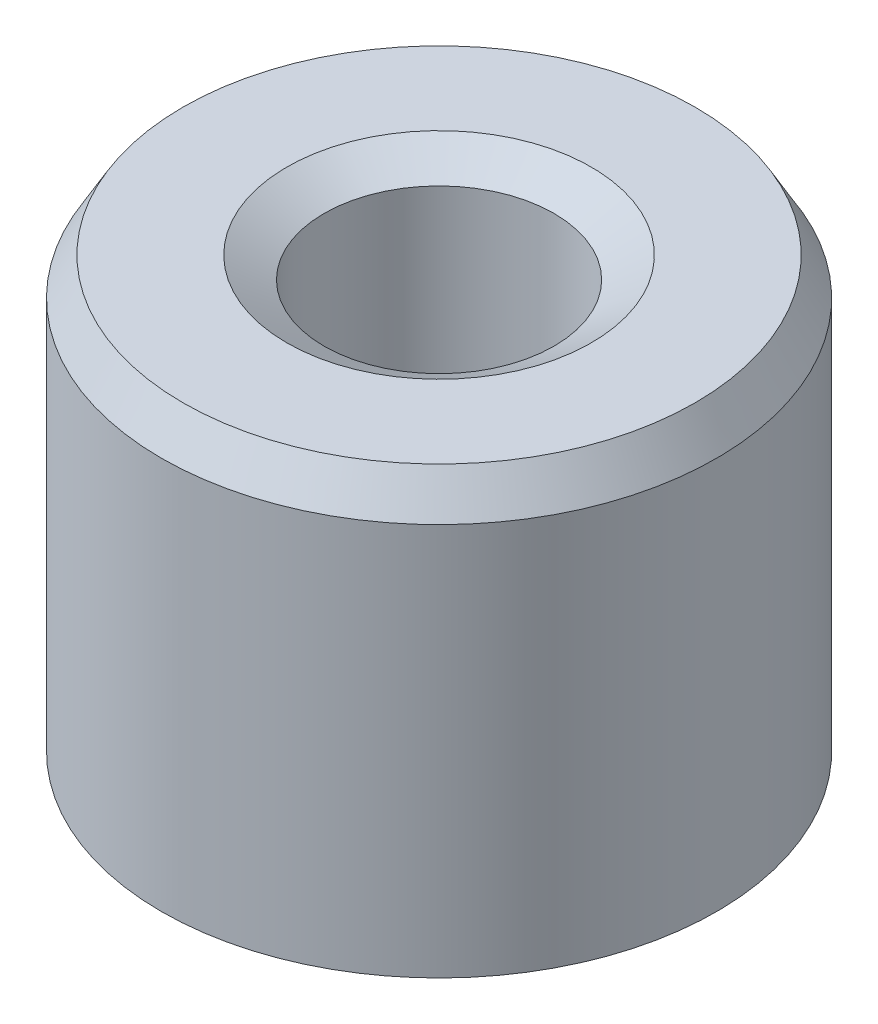
from build123d import *
from OCP.BRepFilletAPI import BRepFilletAPI_MakeChamfer

# Parameters (mm, degrees)
SKETCH1_R           = 25
BOSS_EXTRUDE1_DEPTH = 40.651912495
SKETCH2_R           = 10.355693832
CUT_EXTRUDE1_DEPTH  = 54.875578786
CHAMFER1_SIZE       = 3.356631044
CHAMFER1_SIZE2      = 1.937951837


with BuildPart() as part:
    # Sketch1 → Boss-Extrude1 (new body)
    with BuildSketch(Plane(origin=(0, 0, 0), x_dir=(1, 0, 0), z_dir=(0, 1, 0))):
        Circle(SKETCH1_R)
    extrude(amount=BOSS_EXTRUDE1_DEPTH)

    # Sketch2 → Cut-Extrude1 (cut, through all)
    with BuildSketch(Plane(origin=(0, 0, 0), x_dir=(1, 0, 0), z_dir=(0, 1, 0))):
        Circle(SKETCH2_R)
    extrude(amount=CUT_EXTRUDE1_DEPTH, mode=Mode.SUBTRACT)

    # Chamfer1: one chamfer whose edges measure the first distance from different faces: ONE call of the kernel's chamfer builder (chamfer() names one face for all edges)
    chamfer1_edges_1 = [part.edges().sort_by_distance(p)[0] for p in [
        (-10.355693832, 40.651912495, 0),
    ]]
    chamfer1_side_1 = [part.faces().sort_by_distance(p)[0] for p in [
        (-24.292893219, 40.651912495, 0),
    ]]
    chamfer1_edges_2 = [part.edges().sort_by_distance(p)[0] for p in [
        (-10.355693832, 0, 0),
    ]]
    chamfer1_side_2 = [part.faces().sort_by_distance(p)[0] for p in [
        (-10.355693832, 20.325956248, 0),
    ]]
    chamfer1_edges_3 = [part.edges().sort_by_distance(p)[0] for p in [
        (-25, 0, 0),
    ]]
    chamfer1_side_3 = [part.faces().sort_by_distance(p)[0] for p in [
        (-24.292893219, 0, 0),
    ]]
    chamfer1_edges_4 = [part.edges().sort_by_distance(p)[0] for p in [
        (-25, 40.651912495, 0),
    ]]
    chamfer1_side_4 = [part.faces().sort_by_distance(p)[0] for p in [
        (-25, 20.325956248, 0),
    ]]
    chamfer1 = BRepFilletAPI_MakeChamfer(part.part.solid().wrapped)
    for e in chamfer1_edges_1:
        chamfer1.Add(CHAMFER1_SIZE, CHAMFER1_SIZE2, e.wrapped, chamfer1_side_1[0].wrapped)  # the first distance lies on this face
    for e in chamfer1_edges_2:
        chamfer1.Add(CHAMFER1_SIZE, CHAMFER1_SIZE2, e.wrapped, chamfer1_side_2[0].wrapped)  # the first distance lies on this face
    for e in chamfer1_edges_3:
        chamfer1.Add(CHAMFER1_SIZE, CHAMFER1_SIZE2, e.wrapped, chamfer1_side_3[0].wrapped)  # the first distance lies on this face
    for e in chamfer1_edges_4:
        chamfer1.Add(CHAMFER1_SIZE, CHAMFER1_SIZE2, e.wrapped, chamfer1_side_4[0].wrapped)  # the first distance lies on this face
    add(Compound.cast(chamfer1.Shape()), mode=Mode.REPLACE)


solid = part.part
